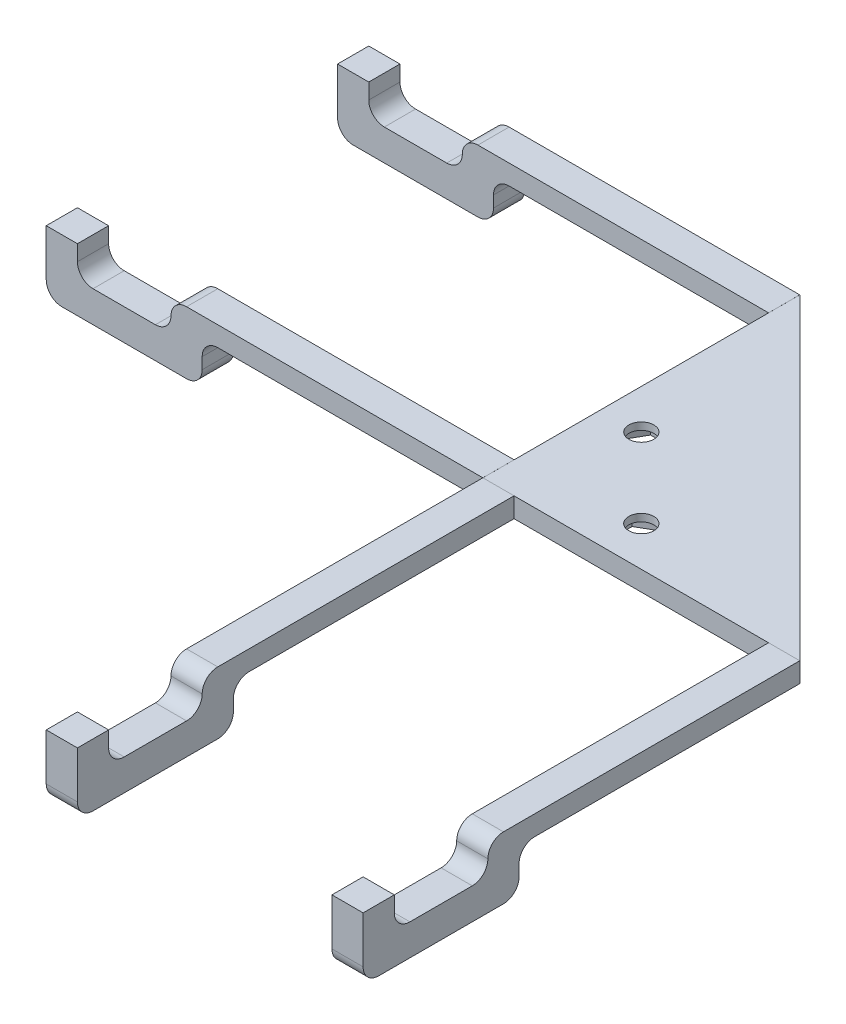
from build123d import *

# Parameters (mm, degrees)
BOSS_EXTRUDE1_DEPTH   = 3.175
SKETCH2_R             = 2
CUT_EXTRUDE1_DEPTH    = 72.912172996
CUT_EXTRUDE2_START    = -3.175
CUT_EXTRUDE2_DEPTH    = 2
SKETCH5_W             = 5
SKETCH5_H             = 45
BOSS_EXTRUDE6_DEPTH   = 3.18
BOSS_EXTRUDE6_2_DEPTH = 3.18
SKETCH5_W_2           = 45
SKETCH5_H_2           = 5
BOSS_EXTRUDE6_3_DEPTH = 3.18
SKETCH5_W_3           = 44.095460655
BOSS_EXTRUDE6_4_DEPTH = 3.18
BOSS_EXTRUDE7_DEPTH   = 5
FILLET1_START         = 45
FILLET1_DEPTH         = 7
FILLET1_START_2       = 45.8
FILLET1_2_DEPTH       = 5
BOSS_EXTRUDE8_DEPTH   = 5
FILLET2_START         = -1
FILLET2_DEPTH         = 7
FILLET2_2_DEPTH       = 5
BOSS_EXTRUDE9_DEPTH   = 5
FILLET3_START         = -6
FILLET3_DEPTH         = 7
FILLET3_START_2       = -5
FILLET3_2_DEPTH       = 5
BOSS_EXTRUDE10_DEPTH  = 5
FILLET4_START         = -52
FILLET4_DEPTH         = 7
FILLET4_START_2       = -50.8
FILLET4_2_DEPTH       = 5


with BuildPart() as part:
    # Sketch1 → Boss-Extrude1 (new body)
    with BuildSketch(Plane(origin=(0, 0, 0), x_dir=(1, 0, 0), z_dir=(0, 1, 0))):
        Polygon((0, 0), (50.8, 0), (0, 50.8), align=None)
    extrude(amount=BOSS_EXTRUDE1_DEPTH)

    # Sketch2 → Cut-Extrude1 (cut, through all)
    with BuildSketch(Plane(origin=(0, 3.175, 0), x_dir=(1, 0, 0), z_dir=(0, 1, 0))):
        with Locations(Location((19.05, 6.35, 0), (0, 0, 270))):
            Circle(SKETCH2_R)
        with Locations(Location((6.35, 19.05, 0), (0, 0, 90))):
            Circle(SKETCH2_R)
    extrude(amount=-CUT_EXTRUDE1_DEPTH, mode=Mode.SUBTRACT)

    # Sketch3 → Cut-Extrude2 (cut)
    with BuildSketch(Plane(origin=(0, 3.175, 0), x_dir=(1, 0, 0), z_dir=(0, 1, 0)).offset(CUT_EXTRUDE2_START)):
        Polygon((8.370723055, 15.550005), (10.391446111, 19.05), (8.370723055, 22.549995), (4.329276945, 22.549995), (2.308553889, 19.05), (4.329276945, 15.550005), align=None)
        Polygon((22.549995, 4.329276945), (19.05, 2.308553889), (15.550005, 4.329276945), (15.550005, 8.370723055), (19.05, 10.391446111), (22.549995, 8.370723055), align=None)
    extrude(amount=CUT_EXTRUDE2_DEPTH, mode=Mode.SUBTRACT)


with BuildPart() as body_2:
    # Sketch5 → Boss-Extrude6 (new body)
    with BuildSketch(Plane(origin=(0, 0, 0), x_dir=(1, 0, 0), z_dir=(0, 1, 0))):
        with Locations((48.3, -22.5)):
            Rectangle(SKETCH5_W, SKETCH5_H)
    extrude(amount=BOSS_EXTRUDE6_DEPTH)

    # Sketch7 → Boss-Extrude7 (add)
    with BuildSketch(Plane(origin=(50.8, 0, 0), x_dir=(0, 0, -1), z_dir=(1, 0, 0))):
        Polygon((-45, 3.18), (-50, 3.18), (-50, -1.82), (-65, -1.82), (-65, 3.18), (-70, 3.18), (-70, -6.82), (-45, -6.82), align=None)
    extrude(amount=-BOSS_EXTRUDE7_DEPTH)

    # Fillet1: read off the stored shape, not the designer's step
    # Fillet1 outline → Fillet1 (cut)
    with BuildSketch(Plane.YZ.offset(FILLET1_START)):
        with BuildLine():
            ThreePointArc((-4.32, 45), (-6.087766953, 45.732233047), (-6.82, 47.5))
            Line((-6.82, 47.5), (-6.82, 45))
            Line((-6.82, 45), (-4.32, 45))
        make_face()
        with BuildLine():
            Line((3.18, 50), (0.68, 50))
            ThreePointArc((0.68, 50), (2.447766953, 49.267766953), (3.18, 47.5))
            Line((3.18, 47.5), (3.18, 50))
        make_face()
        with BuildLine():
            ThreePointArc((-6.82, 67.5), (-6.087766953, 69.267766953), (-4.32, 70))
            Line((-4.32, 70), (-6.82, 70))
            Line((-6.82, 70), (-6.82, 67.5))
        make_face()
    extrude(amount=FILLET1_DEPTH, mode=Mode.SUBTRACT)

    # Fillet1 2 outline → Fillet1 2 (add)
    with BuildSketch(Plane.YZ.offset(FILLET1_START_2)):
        with BuildLine():
            Line((0, 45), (-2.5, 45))
            ThreePointArc((-2.5, 45), (-0.732233047, 44.267766953), (0, 42.5))
            Line((0, 42.5), (0, 45))
        make_face()
        with BuildLine():
            ThreePointArc((0.68, 50), (-1.087766953, 50.732233047), (-1.82, 52.5))
            Line((-1.82, 52.5), (-1.82, 50))
            Line((-1.82, 50), (0.68, 50))
        make_face()
        with BuildLine():
            ThreePointArc((-1.82, 62.5), (-1.087766953, 64.267766953), (0.68, 65))
            Line((0.68, 65), (-1.82, 65))
            Line((-1.82, 65), (-1.82, 62.5))
        make_face()
    extrude(amount=FILLET1_2_DEPTH)


with BuildPart() as body_3:
    # Sketch5 → Boss-Extrude6 2 (new body)
    with BuildSketch(Plane(origin=(0, 0, 0), x_dir=(1, 0, 0), z_dir=(0, 1, 0))):
        with Locations((2.5, -22.5)):
            Rectangle(SKETCH5_W, SKETCH5_H)
    extrude(amount=BOSS_EXTRUDE6_2_DEPTH)

    # Sketch9 → Boss-Extrude8 (add)
    with BuildSketch(Plane(origin=(5, 0, 0), x_dir=(0, 0, -1), z_dir=(1, 0, 0))):
        Polygon((-45, 3.18), (-45, -6.82), (-70, -6.82), (-70, 3.18), (-65, 3.18), (-65, -1.82), (-50, -1.82), (-50, 3.18), align=None)
    extrude(amount=-BOSS_EXTRUDE8_DEPTH)

    # Fillet2: read off the stored shape, not the designer's step
    # Fillet2 outline → Fillet2 (cut)
    with BuildSketch(Plane.YZ.offset(FILLET2_START)):
        with BuildLine():
            Line((3.18, 50), (0.68, 50))
            ThreePointArc((0.68, 50), (2.447766953, 49.267766953), (3.18, 47.5))
            Line((3.18, 47.5), (3.18, 50))
        make_face()
        with BuildLine():
            ThreePointArc((-4.32, 45), (-6.087766953, 45.732233047), (-6.82, 47.5))
            Line((-6.82, 47.5), (-6.82, 45))
            Line((-6.82, 45), (-4.32, 45))
        make_face()
        with BuildLine():
            ThreePointArc((-6.82, 67.5), (-6.087766953, 69.267766953), (-4.32, 70))
            Line((-4.32, 70), (-6.82, 70))
            Line((-6.82, 70), (-6.82, 67.5))
        make_face()
    extrude(amount=FILLET2_DEPTH, mode=Mode.SUBTRACT)

    # Fillet2 2 outline → Fillet2 2 (add)
    with BuildSketch(Plane.YZ):
        with BuildLine():
            Line((-1.82, 65), (-1.82, 62.5))
            ThreePointArc((-1.82, 62.5), (-1.087766953, 64.267766953), (0.68, 65))
            Line((0.68, 65), (-1.82, 65))
        make_face()
        with BuildLine():
            ThreePointArc((0.68, 50), (-1.087766953, 50.732233047), (-1.82, 52.5))
            Line((-1.82, 52.5), (-1.82, 50))
            Line((-1.82, 50), (0.68, 50))
        make_face()
        with BuildLine():
            Line((0, 45), (-2.5, 45))
            ThreePointArc((-2.5, 45), (-0.732233047, 44.267766953), (0, 42.5))
            Line((0, 42.5), (0, 45))
        make_face()
    extrude(amount=FILLET2_2_DEPTH)


with BuildPart() as body_4:
    # Sketch5 → Boss-Extrude6 3 (new body)
    with BuildSketch(Plane(origin=(0, 0, 0), x_dir=(1, 0, 0), z_dir=(0, 1, 0))):
        with Locations((-22.5, 2.5)):
            Rectangle(SKETCH5_W_2, SKETCH5_H_2)
    extrude(amount=BOSS_EXTRUDE6_3_DEPTH)

    # Sketch10 → Boss-Extrude9 (add)
    with BuildSketch(Plane.XY):
        Polygon((-45, 3.18), (-45, -6.82), (-70, -6.82), (-70, 3.18), (-65, 3.18), (-65, -1.82), (-50, -1.82), (-50, 3.18), align=None)
    extrude(amount=-BOSS_EXTRUDE9_DEPTH)

    # Fillet3: read off the stored shape, not the designer's step
    # Fillet3 outline → Fillet3 (cut)
    with BuildSketch(Plane.XY.offset(FILLET3_START)):
        with BuildLine():
            Line((-50, 3.18), (-50, 0.68))
            ThreePointArc((-50, 0.68), (-49.267766953, 2.447766953), (-47.5, 3.18))
            Line((-47.5, 3.18), (-50, 3.18))
        make_face()
        with BuildLine():
            ThreePointArc((-45, -4.32), (-45.732233047, -6.087766953), (-47.5, -6.82))
            Line((-47.5, -6.82), (-45, -6.82))
            Line((-45, -6.82), (-45, -4.32))
        make_face()
        with BuildLine():
            ThreePointArc((-67.5, -6.82), (-69.267766953, -6.087766953), (-70, -4.32))
            Line((-70, -4.32), (-70, -6.82))
            Line((-70, -6.82), (-67.5, -6.82))
        make_face()
    extrude(amount=FILLET3_DEPTH, mode=Mode.SUBTRACT)

    # Fillet3 2 outline → Fillet3 2 (add)
    with BuildSketch(Plane.XY.offset(FILLET3_START_2)):
        with BuildLine():
            Line((-65, -1.82), (-62.5, -1.82))
            ThreePointArc((-62.5, -1.82), (-64.267766953, -1.087766953), (-65, 0.68))
            Line((-65, 0.68), (-65, -1.82))
        make_face()
        with BuildLine():
            ThreePointArc((-50, 0.68), (-50.732233047, -1.087766953), (-52.5, -1.82))
            Line((-52.5, -1.82), (-50, -1.82))
            Line((-50, -1.82), (-50, 0.68))
        make_face()
        with BuildLine():
            Line((-45, 0), (-45, -2.5))
            ThreePointArc((-45, -2.5), (-44.267766953, -0.732233047), (-42.5, 0))
            Line((-42.5, 0), (-45, 0))
        make_face()
    extrude(amount=FILLET3_2_DEPTH)


with BuildPart() as body_5:
    # Sketch5 → Boss-Extrude6 4 (new body)
    with BuildSketch(Plane(origin=(0, 0, 0), x_dir=(1, 0, 0), z_dir=(0, 1, 0))):
        with Locations((-22.047730328, 48.3)):
            Rectangle(SKETCH5_W_3, SKETCH5_H_2)
    extrude(amount=BOSS_EXTRUDE6_4_DEPTH)

    # Sketch12 → Boss-Extrude10 (add)
    with BuildSketch(Plane.XY.offset(-45.8)):
        Polygon((-44.095460655, 3.18), (-44.095460655, -6.82), (-69.095460655, -6.82), (-69.095460655, 3.18), (-64.095460655, 3.18), (-64.095460655, -1.82), (-49.095460655, -1.82), (-49.095460655, 3.18), align=None)
    extrude(amount=-BOSS_EXTRUDE10_DEPTH)

    # Fillet4: read off the stored shape, not the designer's step
    # Fillet4 outline → Fillet4 (cut)
    with BuildSketch(Plane.XY.offset(FILLET4_START)):
        with BuildLine():
            Line((-49.095460655, 3.18), (-49.095460655, 0.68))
            ThreePointArc((-49.095460655, 0.68), (-48.363227608, 2.447766953), (-46.595460655, 3.18))
            Line((-46.595460655, 3.18), (-49.095460655, 3.18))
        make_face()
        with BuildLine():
            ThreePointArc((-44.095460655, -4.32), (-44.827693702, -6.087766953), (-46.595460655, -6.82))
            Line((-46.595460655, -6.82), (-44.095460655, -6.82))
            Line((-44.095460655, -6.82), (-44.095460655, -4.32))
        make_face()
        with BuildLine():
            ThreePointArc((-66.595460655, -6.82), (-68.363227608, -6.087766953), (-69.095460655, -4.32))
            Line((-69.095460655, -4.32), (-69.095460655, -6.82))
            Line((-69.095460655, -6.82), (-66.595460655, -6.82))
        make_face()
    extrude(amount=FILLET4_DEPTH, mode=Mode.SUBTRACT)

    # Fillet4 2 outline → Fillet4 2 (add)
    with BuildSketch(Plane.XY.offset(FILLET4_START_2)):
        with BuildLine():
            Line((-64.095460655, -1.82), (-61.595460655, -1.82))
            ThreePointArc((-61.595460655, -1.82), (-63.363227608, -1.087766953), (-64.095460655, 0.68))
            Line((-64.095460655, 0.68), (-64.095460655, -1.82))
        make_face()
        with BuildLine():
            ThreePointArc((-49.095460655, 0.68), (-49.827693702, -1.087766953), (-51.595460655, -1.82))
            Line((-51.595460655, -1.82), (-49.095460655, -1.82))
            Line((-49.095460655, -1.82), (-49.095460655, 0.68))
        make_face()
        with BuildLine():
            Line((-44.095460655, 0), (-44.095460655, -2.5))
            ThreePointArc((-44.095460655, -2.5), (-43.363227608, -0.732233047), (-41.595460655, 0))
            Line((-41.595460655, 0), (-44.095460655, 0))
        make_face()
    extrude(amount=FILLET4_2_DEPTH)


solid = Compound([part.part, body_2.part, body_3.part, body_4.part, body_5.part])
